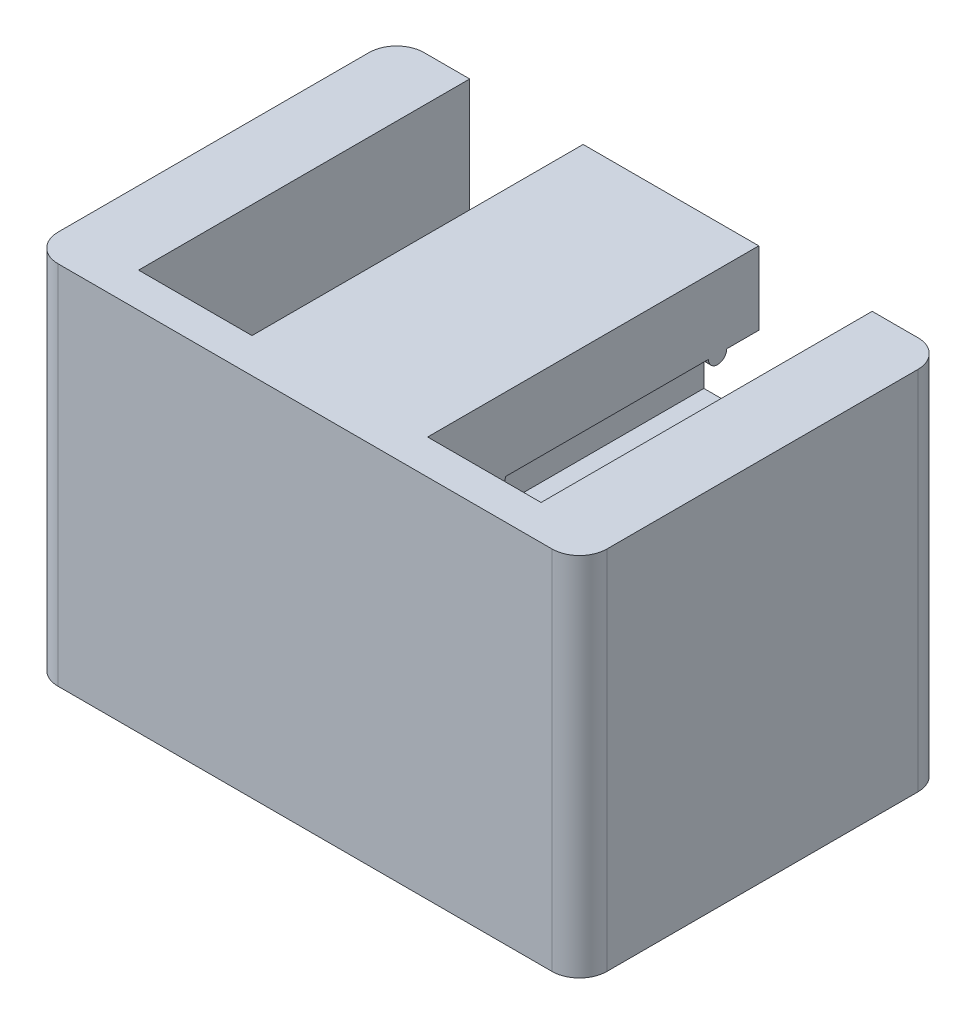
from build123d import *
from OCP.BRepFilletAPI import BRepFilletAPI_MakeChamfer

# Parameters (mm, degrees)
BOSS_EXTRUDE1_DEPTH           = 10
BOSS_EXTRUDE1_DEPTH_BACK      = 20
SKETCH12_R                    = 15
CUT_EXTRUDE9_DEPTH            = 8
CHAMFER1_SIZE                 = 1.5
CHAMFER1_SIZE2                = 0.46241
FILLET11_R                    = 0.78
CHAMFER2_SIZE2                = 5
CHAMFER2_SIZE                 = 8
CUT_EXTRUDE10_START           = -3
SKETCH18_W                    = 25.5
SKETCH18_H                    = 24.1
CUT_EXTRUDE10_DEPTH           = 4.1
SKETCH19_W                    = 8.6
SKETCH19_H                    = 8.6
CUT_EXTRUDE13_DEPTH           = 3.7
CUT_EXTRUDE14_DEPTH           = 2
SKETCH21_R                    = 3.8
CUT_EXTRUDE15_DEPTH           = 116.348128402
SKETCH10_R                    = 12.5
CUT_EXTRUDE8_DEPTH            = 3
SKETCH22_R                    = 0.95
BOSS_EXTRUDE5_DEPTH           = 1.1
BOSS_EXTRUDE5_DRAFT           = 30
BOSS_EXTRUDE5_PROFILE_2_DEPTH = 1.1
BOSS_EXTRUDE5_PROFILE_2_DRAFT = 30
BOSS_EXTRUDE5_PROFILE_3_DEPTH = 1.1
BOSS_EXTRUDE5_PROFILE_3_DRAFT = 30
BOSS_EXTRUDE5_PROFILE_4_DEPTH = 1.1
BOSS_EXTRUDE5_PROFILE_4_DRAFT = 30
CUT_EXTRUDE16_DEPTH           = 8.5
FILLET13_R                    = 2
BOSS_EXTRUDE6_DEPTH           = 3
LPATTERN1_COUNT               = 2
LPATTERN1_PITCH               = 150
LPATTERN1_COPY_1_SKETCH_R     = 0.95
LPATTERN1_COPY_1_DEPTH        = 1.1
LPATTERN1_COPY_1_DRAFT        = 30
LPATTERN1_COPY_2_SKETCH_R     = 0.95
LPATTERN1_COPY_2_DEPTH        = 1.1
LPATTERN1_COPY_2_DRAFT        = 30
LPATTERN1_COPY_3_SKETCH_R     = 0.95
LPATTERN1_COPY_3_DEPTH        = 1.1
LPATTERN1_COPY_3_DRAFT        = 30
LPATTERN1_COPY_4_SKETCH_R     = 0.95
LPATTERN1_COPY_4_DEPTH        = 1.1
LPATTERN1_COPY_4_DRAFT        = 30
LPATTERN1_COPY_5_SKETCH_R     = 0.95
LPATTERN1_COPY_5_DEPTH        = 1.1
LPATTERN1_COPY_5_DRAFT        = 30
LPATTERN1_COPY_6_SKETCH_R     = 0.95
LPATTERN1_COPY_6_DEPTH        = 1.1
LPATTERN1_COPY_6_DRAFT        = 30
LPATTERN1_COPY_7_SKETCH_R     = 0.95
LPATTERN1_COPY_7_DEPTH        = 1.1
LPATTERN1_COPY_7_DRAFT        = 30
FILLET13_OF_LPATTERN1_R       = 2
FILLET12_R                    = 100
FILLET14_R                    = 1
SKETCH32_R                    = 4.55
SKETCH32_R_2                  = 4.5
CUT_EXTRUDE17_DEPTH           = 3
SKETCH33_R                    = 2.75
CUT_EXTRUDE18_DEPTH           = 114.802213105
CUT_EXTRUDE19_DEPTH           = 5
SKETCH56_W                    = 30
SKETCH56_H                    = 20
BOSS_EXTRUDE10_DEPTH          = 20
CUT_EXTRUDE21_DEPTH           = 18.1
FILLET15_R                    = 1.5


# Read off the part's stored shape, not the designer's step: Split3
# Some blends are built 0.0001 mm under size
with BuildPart() as part:
    # Sketch1 → Boss-Extrude1 (new, two sides: drawn at the far end of the back side and taken through both)
    with BuildSketch(Plane.XY.offset(-BOSS_EXTRUDE1_DEPTH_BACK)):
        with BuildLine():
            Line((-100, -15), (0, -51.866662613))
            Line((0, -51.866662613), (100, -15))
            Line((100, -15), (100, 15))
            Line((100, 15), (60, 15))
            add(Edge.make_bspline(
                [(-60, 15), (-39.699350007, 14.814430853), (0, 45.185569147), (39.699350007, 14.814430853), (60, 15)],
                knots=[0, 0, 0, 0, 0.5, 1, 1, 1, 1], degree=3))
            Line((-60, 15), (-100, 15))
            Line((-100, 15), (-100, -15))
        make_face()
        with BuildLine():
            Line((3.188323159, 2.335673435), (2.875864874, 2.765735369))
            Line((2.875864874, 2.765735369), (4.089390366, 3.647413248))
            Line((4.089390366, 3.647413248), (4.40184865, 3.217351313))
            ThreePointArc((4.40184865, 3.217351313), (5.258610463, 4.17939586), (5.908815238, 5.29151288))
            Line((5.908815238, 5.29151288), (5.403247113, 5.455781921))
            Line((5.403247113, 5.455781921), (5.866772605, 6.882366696))
            Line((5.866772605, 6.882366696), (6.37234073, 6.718097654))
            ThreePointArc((6.37234073, 6.718097654), (6.5, 8), (6.37234073, 9.281902346))
            Line((6.37234073, 9.281902346), (5.866772605, 9.117633304))
            Line((5.866772605, 9.117633304), (5.403247113, 10.544218079))
            Line((5.403247113, 10.544218079), (5.908815238, 10.70848712))
            ThreePointArc((5.908815238, 10.70848712), (5.258610463, 11.82060414), (4.40184865, 12.782648687))
            Line((4.40184865, 12.782648687), (4.089390366, 12.352586752))
            Line((4.089390366, 12.352586752), (2.875864874, 13.234264631))
            Line((2.875864874, 13.234264631), (3.188323159, 13.664326565))
            ThreePointArc((3.188323159, 13.664326565), (2.008610463, 14.181867356), (0.75, 14.456585785))
            Line((0.75, 14.456585785), (0.75, 13.925))
            Line((0.75, 13.925), (-0.75, 13.925))
            Line((-0.75, 13.925), (-0.75, 14.456585785))
            ThreePointArc((-0.75, 14.456585785), (-2.008610463, 14.181867356), (-3.188323159, 13.664326565))
            Line((-3.188323159, 13.664326565), (-2.875864874, 13.234264631))
            Line((-2.875864874, 13.234264631), (-4.089390366, 12.352586752))
            Line((-4.089390366, 12.352586752), (-4.40184865, 12.782648687))
            ThreePointArc((-4.40184865, 12.782648687), (-5.258610463, 11.82060414), (-5.908815238, 10.70848712))
            Line((-5.908815238, 10.70848712), (-5.403247113, 10.544218079))
            Line((-5.403247113, 10.544218079), (-5.866772605, 9.117633304))
            Line((-5.866772605, 9.117633304), (-6.37234073, 9.281902346))
            ThreePointArc((-6.37234073, 9.281902346), (-6.5, 8), (-6.37234073, 6.718097654))
            Line((-6.37234073, 6.718097654), (-5.866772605, 6.882366696))
            Line((-5.866772605, 6.882366696), (-5.403247113, 5.455781921))
            Line((-5.403247113, 5.455781921), (-5.908815238, 5.29151288))
            ThreePointArc((-5.908815238, 5.29151288), (-5.258610463, 4.17939586), (-4.40184865, 3.217351313))
            Line((-4.40184865, 3.217351313), (-4.089390366, 3.647413248))
            Line((-4.089390366, 3.647413248), (-2.875864874, 2.765735369))
            Line((-2.875864874, 2.765735369), (-3.188323159, 2.335673435))
            ThreePointArc((-3.188323159, 2.335673435), (-2.008610463, 1.818132644), (-0.75, 1.543414215))
            Line((-0.75, 1.543414215), (-0.75, 2.075))
            Line((-0.75, 2.075), (0.75, 2.075))
            Line((0.75, 2.075), (0.75, 1.543414215))
            ThreePointArc((0.75, 1.543414215), (2.008610463, 1.818132644), (3.188323159, 2.335673435))
        make_face(mode=Mode.SUBTRACT)
    extrude(amount=BOSS_EXTRUDE1_DEPTH + BOSS_EXTRUDE1_DEPTH_BACK)

    # Sketch12 → Cut-Extrude9 (cut)
    with BuildSketch(Plane(origin=(0, 0, -20), x_dir=(-1, 0, 0), z_dir=(0, 0, -1))):
        with Locations((0, 8)):
            Circle(SKETCH12_R)
    extrude(amount=-CUT_EXTRUDE9_DEPTH, mode=Mode.SUBTRACT)

    # Chamfer1: one chamfer whose edges measure the first distance from different faces: ONE call of the kernel's chamfer builder (chamfer() names one face for all edges)
    chamfer1_edges_1 = [part.edges().sort_by_distance(p)[0] for p in [
        (0, 2.075, -12),
    ]]
    chamfer1_side_1 = [part.faces().sort_by_distance(p)[0] for p in [
        (0, 2.075, -1),
    ]]
    chamfer1_edges_2 = [part.edges().sort_by_distance(p)[0] for p in [
        (3.48262762, 3.206574308, -12),
    ]]
    chamfer1_side_2 = [part.faces().sort_by_distance(p)[0] for p in [
        (3.48262762, 3.206574308, -1),
    ]]
    chamfer1_edges_3 = [part.edges().sort_by_distance(p)[0] for p in [
        (5.635009859, 6.169074308, -12),
    ]]
    chamfer1_side_3 = [part.faces().sort_by_distance(p)[0] for p in [
        (5.635009859, 6.169074308, -1),
    ]]
    chamfer1_edges_4 = [part.edges().sort_by_distance(p)[0] for p in [
        (5.635009859, 9.830925692, -12),
    ]]
    chamfer1_side_4 = [part.faces().sort_by_distance(p)[0] for p in [
        (5.635009859, 9.830925692, -1),
    ]]
    chamfer1_edges_5 = [part.edges().sort_by_distance(p)[0] for p in [
        (3.48262762, 12.793425692, -12),
    ]]
    chamfer1_side_5 = [part.faces().sort_by_distance(p)[0] for p in [
        (3.48262762, 12.793425692, -1),
    ]]
    chamfer1_edges_6 = [part.edges().sort_by_distance(p)[0] for p in [
        (0, 13.925, -12),
    ]]
    chamfer1_side_6 = [part.faces().sort_by_distance(p)[0] for p in [
        (0, 13.925, -1),
    ]]
    chamfer1_edges_7 = [part.edges().sort_by_distance(p)[0] for p in [
        (-3.48262762, 12.793425692, -12),
    ]]
    chamfer1_side_7 = [part.faces().sort_by_distance(p)[0] for p in [
        (-3.48262762, 12.793425692, -1),
    ]]
    chamfer1_edges_8 = [part.edges().sort_by_distance(p)[0] for p in [
        (-5.635009859, 9.830925692, -12),
    ]]
    chamfer1_side_8 = [part.faces().sort_by_distance(p)[0] for p in [
        (-5.635009859, 9.830925692, -1),
    ]]
    chamfer1_edges_9 = [part.edges().sort_by_distance(p)[0] for p in [
        (-5.635009859, 6.169074308, -12),
    ]]
    chamfer1_side_9 = [part.faces().sort_by_distance(p)[0] for p in [
        (-5.635009859, 6.169074308, -1),
    ]]
    chamfer1_edges_10 = [part.edges().sort_by_distance(p)[0] for p in [
        (-3.48262762, 3.206574308, -12),
    ]]
    chamfer1_side_10 = [part.faces().sort_by_distance(p)[0] for p in [
        (-3.48262762, 3.206574308, -1),
    ]]
    chamfer1 = BRepFilletAPI_MakeChamfer(part.part.solid().wrapped)
    for e in chamfer1_edges_1:
        chamfer1.Add(CHAMFER1_SIZE, CHAMFER1_SIZE2, e.wrapped, chamfer1_side_1[0].wrapped)  # the first distance lies on this face
    for e in chamfer1_edges_2:
        chamfer1.Add(CHAMFER1_SIZE, CHAMFER1_SIZE2, e.wrapped, chamfer1_side_2[0].wrapped)  # the first distance lies on this face
    for e in chamfer1_edges_3:
        chamfer1.Add(CHAMFER1_SIZE, CHAMFER1_SIZE2, e.wrapped, chamfer1_side_3[0].wrapped)  # the first distance lies on this face
    for e in chamfer1_edges_4:
        chamfer1.Add(CHAMFER1_SIZE, CHAMFER1_SIZE2, e.wrapped, chamfer1_side_4[0].wrapped)  # the first distance lies on this face
    for e in chamfer1_edges_5:
        chamfer1.Add(CHAMFER1_SIZE, CHAMFER1_SIZE2, e.wrapped, chamfer1_side_5[0].wrapped)  # the first distance lies on this face
    for e in chamfer1_edges_6:
        chamfer1.Add(CHAMFER1_SIZE, CHAMFER1_SIZE2, e.wrapped, chamfer1_side_6[0].wrapped)  # the first distance lies on this face
    for e in chamfer1_edges_7:
        chamfer1.Add(CHAMFER1_SIZE, CHAMFER1_SIZE2, e.wrapped, chamfer1_side_7[0].wrapped)  # the first distance lies on this face
    for e in chamfer1_edges_8:
        chamfer1.Add(CHAMFER1_SIZE, CHAMFER1_SIZE2, e.wrapped, chamfer1_side_8[0].wrapped)  # the first distance lies on this face
    for e in chamfer1_edges_9:
        chamfer1.Add(CHAMFER1_SIZE, CHAMFER1_SIZE2, e.wrapped, chamfer1_side_9[0].wrapped)  # the first distance lies on this face
    for e in chamfer1_edges_10:
        chamfer1.Add(CHAMFER1_SIZE, CHAMFER1_SIZE2, e.wrapped, chamfer1_side_10[0].wrapped)  # the first distance lies on this face
    add(Compound.cast(chamfer1.Shape()), mode=Mode.REPLACE)

    # Fillet11
    # the kernel refuses this fillet: 0.78 mm, written as the material it takes off along each edge
    with BuildSketch(Plane(origin=(-4.089390366, 12.352586752, -12.348462837), x_dir=(-0.5877852522924715, 0.8090169943749486, 0), z_dir=(0, 0, 1)), Plane(origin=(-5.866772605, 9.117633304, -12.348462837), x_dir=(-0.9510565162951549, 0.3090169943749433, 0), z_dir=(0, 0, 1)), Plane(origin=(-0.75, 13.925, -12.348462837), x_dir=(0, 1, 0), z_dir=(0, 0, 1)), Plane(origin=(2.875864874, 13.234264631, -12.348462837), x_dir=(0.5877852522924727, 0.8090169943749479, 0), z_dir=(0, 0, 1)), Plane(origin=(5.403247113, 10.544218079, -12.348462837), x_dir=(0.9510565162951538, 0.30901699437494734, 0), z_dir=(0, 0, 1)), Plane(origin=(5.866772605, 6.882366696, -12.348462837), x_dir=(0.9510565162951544, -0.30901699437494534, 0), z_dir=(0, 0, 1)), Plane(origin=(-5.403247113, 5.455781921, -12.348462837), x_dir=(-0.9510565162951544, -0.30901699437494484, 0), z_dir=(0, 0, 1)), Plane(origin=(-2.875864874, 2.765735369, -12.348462837), x_dir=(-0.5877852522924728, -0.8090169943749477, 0), z_dir=(0, 0, 1)), Plane(origin=(0.75, 2.075, -12.348462837), x_dir=(0, -1, 0), z_dir=(0, 0, 1)), Plane(origin=(4.089390366, 3.647413248, -12.348462837), x_dir=(0.5877852522924725, -0.8090169943749479, 0), z_dir=(0, 0, 1))) as fillet11_piece_1:
        with BuildLine():
            CenterArc((0.78, -0.739385135), FILLET11_R, 108.571012268, 71.428987732)
            Line((0, -0.739385135), (-0.0156, -0.739385135))
            Line((-0.0156, -0.739385135), (-0.0156, 0))
            Line((-0.0156, 0), (0, 0.0156))
            ThreePointArc((0, 0.0156), (0.265792893, 0.0156), (0.526617501, 0.014787703))
            Line((0.526617501, 0.014787703), (0.531585785, 0))
        make_face()
    extrude(amount=24.196925675, mode=Mode.SUBTRACT)
    with BuildSketch(Plane(origin=(-5.403247113, 10.544218079, -12.348462837), x_dir=(-0.3090169943749473, -0.9510565162951535, 0), z_dir=(0, 0, 1)), Plane(origin=(-2.875864874, 13.234264631, -12.348462837), x_dir=(-0.809016994374947, -0.5877852522924738, 0), z_dir=(0, 0, 1)), Plane(origin=(0.75, 13.925, -12.348462837), x_dir=(-1, 0, 0), z_dir=(0, 0, 1)), Plane(origin=(4.089390366, 12.352586752, -12.348462837), x_dir=(-0.8090169943749471, 0.5877852522924735, 0), z_dir=(0, 0, 1)), Plane(origin=(5.866772605, 9.117633304, -12.348462837), x_dir=(-0.30901699437494623, 0.951056516295154, 0), z_dir=(0, 0, 1)), Plane(origin=(5.403247113, 5.455781921, -12.348462837), x_dir=(0.30901699437494773, 0.9510565162951536, 0), z_dir=(0, 0, 1)), Plane(origin=(-5.866772605, 6.882366696, -12.348462837), x_dir=(0.3090169943749473, -0.9510565162951536, 0), z_dir=(0, 0, 1)), Plane(origin=(-4.089390366, 3.647413248, -12.348462837), x_dir=(0.809016994374947, -0.5877852522924737, 0), z_dir=(0, 0, 1)), Plane(origin=(-0.75, 2.075, -12.348462837), x_dir=(1, 0, 0), z_dir=(0, 0, 1)), Plane(origin=(2.875864874, 2.765735369, -12.348462837), x_dir=(0.8090169943749471, 0.5877852522924735, 0), z_dir=(0, 0, 1))) as fillet11_piece_2:
        with BuildLine():
            CenterArc((0.739385135, -0.78), FILLET11_R, 90, 71.428987732)
            Line((0, -0.531585785), (-0.014787703, -0.526617501))
            ThreePointArc((-0.014787703, -0.526617501), (-0.0156, -0.265792893), (-0.0156, 0))
            Line((-0.0156, 0), (0, 0.0156))
            Line((0, 0.0156), (0.739385135, 0.0156))
            Line((0.739385135, 0.0156), (0.739385135, 0))
        make_face()
    extrude(amount=24.196925675, mode=Mode.SUBTRACT)

    # Chamfer2
    chamfer2_edges = [part.edges().sort_by_distance(p)[0] for p in [
        (15, 8, -20),
    ]]
    chamfer2_side = [part.faces().sort_by_distance(p)[0] for p in [
        (15, 8, -19.9),
    ]]
    chamfer(chamfer2_edges, length=CHAMFER2_SIZE - 0.0001, length2=CHAMFER2_SIZE2 - 0.0001, reference=chamfer2_side[0])  # a hair under: the kernel refuses the full size

    # Sketch18 → Cut-Extrude10 (cut)
    with BuildSketch(Plane.XY.offset(CUT_EXTRUDE10_START)):
        with Locations((-75, 0.285)):
            Rectangle(SKETCH18_W, SKETCH18_H)
    cut_extrude10 = extrude(amount=CUT_EXTRUDE10_DEPTH, mode=Mode.SUBTRACT)

    # Sketch19 → Cut-Extrude13 (cut)
    with BuildSketch(Plane(origin=(0, 0, 1.1), x_dir=(-1, 0, 0), z_dir=(0, 0, -1))):
        with Locations((75, -2.265)):
            Rectangle(SKETCH19_W, SKETCH19_H)
    cut_extrude13 = extrude(amount=-CUT_EXTRUDE13_DEPTH, mode=Mode.SUBTRACT)

    # Sketch20 → Cut-Extrude14 (cut)
    with BuildSketch(Plane(origin=(0, 0, 1.1), x_dir=(-1, 0, 0), z_dir=(0, 0, -1))):
        Polygon((79.3, 2.035), (79.3, 5.335), (81.5, 5.335), (81.5, 9.835), (70.7, 9.835), (70.7, 2.035), align=None)
    cut_extrude14 = extrude(amount=-CUT_EXTRUDE14_DEPTH, mode=Mode.SUBTRACT)

    # Sketch21 → Cut-Extrude15 (cut, through all)
    with BuildSketch(Plane(origin=(0, 0, 4.8), x_dir=(-1, 0, 0), z_dir=(0, 0, -1))):
        with Locations((75, -2.265)):
            Circle(SKETCH21_R)
    cut_extrude15 = extrude(amount=-CUT_EXTRUDE15_DEPTH, mode=Mode.SUBTRACT)

    # Sketch10 → Cut-Extrude8 (cut)
    with BuildSketch(Plane.XY.offset(10)):
        with Locations((-75, -2.265)):
            Circle(SKETCH10_R)
    cut_extrude8 = extrude(amount=-CUT_EXTRUDE8_DEPTH, mode=Mode.SUBTRACT)


with BuildPart() as boss_extrude5_tool:
    # Sketch22 → Boss-Extrude5 (with draft: the straight prism first)
    with BuildSketch(Plane(origin=(0, 0, 1.1), x_dir=(-1, 0, 0), z_dir=(0, 0, -1))):
        with Locations((64.35, 10.235)):
            Circle(SKETCH22_R)
    extrude(amount=BOSS_EXTRUDE5_DEPTH)
    # Boss-Extrude5: the draft: its side faces are tilted about the plane it starts from
    boss_extrude5_sides = [boss_extrude5_tool.faces().sort_by_distance(p)[0] for p in [
        (-63.4, 10.235, 0.55),
    ]]
    draft(boss_extrude5_sides, Plane(origin=(0, 0, 1.1), x_dir=(-1, 0, 0), z_dir=(0, 0, -1)), BOSS_EXTRUDE5_DRAFT)


with BuildPart() as part_1:
    add(part.part)

    # Boss-Extrude5: add boss_extrude5_tool
    add(boss_extrude5_tool.part)


with BuildPart() as boss_extrude5_profile_2_tool:
    # Sketch22 → Boss-Extrude5 profile 2 (with draft: the straight prism first)
    with BuildSketch(Plane(origin=(0, 0, 1.1), x_dir=(-1, 0, 0), z_dir=(0, 0, -1))):
        with Locations((85.65, 10.235)):
            Circle(SKETCH22_R)
    extrude(amount=BOSS_EXTRUDE5_PROFILE_2_DEPTH)
    # Boss-Extrude5 profile 2: the draft: its side faces are tilted about the plane it starts from
    boss_extrude5_profile_2_sides = [boss_extrude5_profile_2_tool.faces().sort_by_distance(p)[0] for p in [
        (-84.7, 10.235, 0.55),
    ]]
    draft(boss_extrude5_profile_2_sides, Plane(origin=(0, 0, 1.1), x_dir=(-1, 0, 0), z_dir=(0, 0, -1)), BOSS_EXTRUDE5_PROFILE_2_DRAFT)


with BuildPart() as part_2:
    add(part_1.part)

    # Boss-Extrude5 profile 2: add boss_extrude5_profile_2_tool
    add(boss_extrude5_profile_2_tool.part)


with BuildPart() as boss_extrude5_profile_3_tool:
    # Sketch22 → Boss-Extrude5 profile 3 (with draft: the straight prism first)
    with BuildSketch(Plane(origin=(0, 0, 1.1), x_dir=(-1, 0, 0), z_dir=(0, 0, -1))):
        with Locations((85.65, -2.105)):
            Circle(SKETCH22_R)
    extrude(amount=BOSS_EXTRUDE5_PROFILE_3_DEPTH)
    # Boss-Extrude5 profile 3: the draft: its side faces are tilted about the plane it starts from
    boss_extrude5_profile_3_sides = [boss_extrude5_profile_3_tool.faces().sort_by_distance(p)[0] for p in [
        (-84.7, -2.105, 0.55),
    ]]
    draft(boss_extrude5_profile_3_sides, Plane(origin=(0, 0, 1.1), x_dir=(-1, 0, 0), z_dir=(0, 0, -1)), BOSS_EXTRUDE5_PROFILE_3_DRAFT)


with BuildPart() as part_3:
    add(part_2.part)

    # Boss-Extrude5 profile 3: add boss_extrude5_profile_3_tool
    add(boss_extrude5_profile_3_tool.part)


with BuildPart() as boss_extrude5_profile_4_tool:
    # Sketch22 → Boss-Extrude5 profile 4 (with draft: the straight prism first)
    with BuildSketch(Plane(origin=(0, 0, 1.1), x_dir=(-1, 0, 0), z_dir=(0, 0, -1))):
        with Locations((64.35, -2.105)):
            Circle(SKETCH22_R)
    extrude(amount=BOSS_EXTRUDE5_PROFILE_4_DEPTH)
    # Boss-Extrude5 profile 4: the draft: its side faces are tilted about the plane it starts from
    boss_extrude5_profile_4_sides = [boss_extrude5_profile_4_tool.faces().sort_by_distance(p)[0] for p in [
        (-63.4, -2.105, 0.55),
    ]]
    draft(boss_extrude5_profile_4_sides, Plane(origin=(0, 0, 1.1), x_dir=(-1, 0, 0), z_dir=(0, 0, -1)), BOSS_EXTRUDE5_PROFILE_4_DRAFT)


with BuildPart() as part_4:
    add(part_3.part)

    # Boss-Extrude5 profile 4: add boss_extrude5_profile_4_tool
    add(boss_extrude5_profile_4_tool.part)

    # Sketch24 → Cut-Extrude16 (cut, symmetric)
    with BuildSketch(Plane(origin=(-75, 0, 0), x_dir=(0, 0, -1), z_dir=(1, 0, 0))):
        Polygon((0.8, -11.765), (0.8, -19.265), (20, -19.265), (20, -18.065), (2, -18.065), (2, -11.765), align=None)
    cut_extrude16 = extrude(amount=CUT_EXTRUDE16_DEPTH, both=True, mode=Mode.SUBTRACT)

    # Fillet13
    fillet13_edges = [part_4.edges().sort_by_distance(p)[0] for p in [
        (-75, -19.265, -0.8),
        (-75, -18.065, -2),
    ]]
    fillet(fillet13_edges, radius=FILLET13_R)

    # Sketch25 → Boss-Extrude6 (add)
    with BuildSketch(Plane.XY.offset(-3)):
        with BuildLine():
            Line((-84.672341587, 10.739166667), (-83.303552478, 10.739166667))
            ThreePointArc((-83.303552478, 10.739166667), (-83.952943725, 8.537943725), (-86.154166667, 7.888552478))
            Line((-86.154166667, 7.888552478), (-86.154166667, 9.257341587))
            ThreePointArc((-86.154166667, 9.257341587), (-84.872182541, 9.457182541), (-84.672341587, 10.739166667))
        make_face()
        with BuildLine():
            Line((-65.327658413, 10.739166667), (-66.696447522, 10.739166667))
            ThreePointArc((-66.696447522, 10.739166667), (-66.047056275, 8.537943725), (-63.845833333, 7.888552478))
            Line((-63.845833333, 7.888552478), (-63.845833333, 9.257341587))
            ThreePointArc((-63.845833333, 9.257341587), (-65.127817459, 9.457182541), (-65.327658413, 10.739166667))
        make_face()
        with BuildLine():
            Line((-85.65, -1.005), (-85.65, 0.295))
            ThreePointArc((-85.65, 0.295), (-83.25, -2.105), (-85.65, -4.505))
            Line((-85.65, -4.505), (-85.65, -3.205))
            ThreePointArc((-85.65, -3.205), (-84.55, -2.105), (-85.65, -1.005))
        make_face()
        with BuildLine():
            Line((-64.35, -3.205), (-64.35, -4.505))
            ThreePointArc((-64.35, -4.505), (-66.75, -2.105), (-64.35, 0.295))
            Line((-64.35, 0.295), (-64.35, -1.005))
            ThreePointArc((-64.35, -1.005), (-65.45, -2.105), (-64.35, -3.205))
        make_face()
    boss_extrude6 = extrude(amount=BOSS_EXTRUDE6_DEPTH)

    # LPattern1: Cut-Extrude10, Cut-Extrude13, Cut-Extrude14, Cut-Extrude15, Cut-Extrude8, Cut-Extrude16, Boss-Extrude6 ×2
    with Locations(*[(i * LPATTERN1_PITCH, 0, 0) for i in range(1, LPATTERN1_COUNT)]):
        add(cut_extrude10, mode=Mode.SUBTRACT)
        add(cut_extrude13, mode=Mode.SUBTRACT)
        add(cut_extrude14, mode=Mode.SUBTRACT)
        add(cut_extrude15, mode=Mode.SUBTRACT)
        add(cut_extrude8, mode=Mode.SUBTRACT)
        add(cut_extrude16, mode=Mode.SUBTRACT)
        add(boss_extrude6)


with BuildPart() as lpattern1_copy_1_tool:
    # LPattern1 copy 1 sketch → LPattern1 copy 1 (with draft: the straight prism first)
    with BuildSketch(Plane(origin=(150, 0, 1.1), x_dir=(-1, 0, 0), z_dir=(0, 0, -1))):
        with Locations((64.35, 10.235)):
            Circle(LPATTERN1_COPY_1_SKETCH_R)
    extrude(amount=LPATTERN1_COPY_1_DEPTH)
    # LPattern1 copy 1: the draft: its side faces are tilted about the plane it starts from
    lpattern1_copy_1_sides = [lpattern1_copy_1_tool.faces().sort_by_distance(p)[0] for p in [
        (86.6, 10.235, 0.55),
    ]]
    draft(lpattern1_copy_1_sides, Plane(origin=(150, 0, 1.1), x_dir=(-1, 0, 0), z_dir=(0, 0, -1)), LPATTERN1_COPY_1_DRAFT)


with BuildPart() as part_5:
    add(part_4.part)

    # LPattern1 copy 1: add lpattern1_copy_1_tool
    add(lpattern1_copy_1_tool.part)


with BuildPart() as lpattern1_copy_2_tool:
    # LPattern1 copy 2 sketch → LPattern1 copy 2 (with draft: the straight prism first)
    with BuildSketch(Plane(origin=(150, 0, 1.1), x_dir=(-1, 0, 0), z_dir=(0, 0, -1))):
        with Locations((85.65, 10.235)):
            Circle(LPATTERN1_COPY_2_SKETCH_R)
    extrude(amount=LPATTERN1_COPY_2_DEPTH)
    # LPattern1 copy 2: the draft: its side faces are tilted about the plane it starts from
    lpattern1_copy_2_sides = [lpattern1_copy_2_tool.faces().sort_by_distance(p)[0] for p in [
        (65.3, 10.235, 0.55),
    ]]
    draft(lpattern1_copy_2_sides, Plane(origin=(150, 0, 1.1), x_dir=(-1, 0, 0), z_dir=(0, 0, -1)), LPATTERN1_COPY_2_DRAFT)


with BuildPart() as part_6:
    add(part_5.part)

    # LPattern1 copy 2: add lpattern1_copy_2_tool
    add(lpattern1_copy_2_tool.part)


with BuildPart() as lpattern1_copy_3_tool:
    # LPattern1 copy 3 sketch → LPattern1 copy 3 (with draft: the straight prism first)
    with BuildSketch(Plane(origin=(150, 0, 1.1), x_dir=(-1, 0, 0), z_dir=(0, 0, -1))):
        with Locations((85.65, -2.105)):
            Circle(LPATTERN1_COPY_3_SKETCH_R)
    extrude(amount=LPATTERN1_COPY_3_DEPTH)
    # LPattern1 copy 3: the draft: its side faces are tilted about the plane it starts from
    lpattern1_copy_3_sides = [lpattern1_copy_3_tool.faces().sort_by_distance(p)[0] for p in [
        (65.3, -2.105, 0.55),
    ]]
    draft(lpattern1_copy_3_sides, Plane(origin=(150, 0, 1.1), x_dir=(-1, 0, 0), z_dir=(0, 0, -1)), LPATTERN1_COPY_3_DRAFT)


with BuildPart() as part_7:
    add(part_6.part)

    # LPattern1 copy 3: add lpattern1_copy_3_tool
    add(lpattern1_copy_3_tool.part)


with BuildPart() as lpattern1_copy_4_tool:
    # LPattern1 copy 4 sketch → LPattern1 copy 4 (with draft: the straight prism first)
    with BuildSketch(Plane(origin=(150, 0, 1.1), x_dir=(-1, 0, 0), z_dir=(0, 0, -1))):
        with Locations((64.35, -2.105)):
            Circle(LPATTERN1_COPY_4_SKETCH_R)
    extrude(amount=LPATTERN1_COPY_4_DEPTH)
    # LPattern1 copy 4: the draft: its side faces are tilted about the plane it starts from
    lpattern1_copy_4_sides = [lpattern1_copy_4_tool.faces().sort_by_distance(p)[0] for p in [
        (86.6, -2.105, 0.55),
    ]]
    draft(lpattern1_copy_4_sides, Plane(origin=(150, 0, 1.1), x_dir=(-1, 0, 0), z_dir=(0, 0, -1)), LPATTERN1_COPY_4_DRAFT)


with BuildPart() as part_8:
    add(part_7.part)

    # LPattern1 copy 4: add lpattern1_copy_4_tool
    add(lpattern1_copy_4_tool.part)


with BuildPart() as lpattern1_copy_5_tool:
    # LPattern1 copy 5 sketch → LPattern1 copy 5 (with draft: the straight prism first)
    with BuildSketch(Plane(origin=(150, 0, 1.1), x_dir=(-1, 0, 0), z_dir=(0, 0, -1))):
        with Locations((85.65, 10.235)):
            Circle(LPATTERN1_COPY_5_SKETCH_R)
    extrude(amount=LPATTERN1_COPY_5_DEPTH)
    # LPattern1 copy 5: the draft: its side faces are tilted about the plane it starts from
    lpattern1_copy_5_sides = [lpattern1_copy_5_tool.faces().sort_by_distance(p)[0] for p in [
        (65.3, 10.235, 0.55),
    ]]
    draft(lpattern1_copy_5_sides, Plane(origin=(150, 0, 1.1), x_dir=(-1, 0, 0), z_dir=(0, 0, -1)), LPATTERN1_COPY_5_DRAFT)


with BuildPart() as part_9:
    add(part_8.part)

    # LPattern1 copy 5: add lpattern1_copy_5_tool
    add(lpattern1_copy_5_tool.part)


with BuildPart() as lpattern1_copy_6_tool:
    # LPattern1 copy 6 sketch → LPattern1 copy 6 (with draft: the straight prism first)
    with BuildSketch(Plane(origin=(150, 0, 1.1), x_dir=(-1, 0, 0), z_dir=(0, 0, -1))):
        with Locations((85.65, -2.105)):
            Circle(LPATTERN1_COPY_6_SKETCH_R)
    extrude(amount=LPATTERN1_COPY_6_DEPTH)
    # LPattern1 copy 6: the draft: its side faces are tilted about the plane it starts from
    lpattern1_copy_6_sides = [lpattern1_copy_6_tool.faces().sort_by_distance(p)[0] for p in [
        (65.3, -2.105, 0.55),
    ]]
    draft(lpattern1_copy_6_sides, Plane(origin=(150, 0, 1.1), x_dir=(-1, 0, 0), z_dir=(0, 0, -1)), LPATTERN1_COPY_6_DRAFT)


with BuildPart() as part_10:
    add(part_9.part)

    # LPattern1 copy 6: add lpattern1_copy_6_tool
    add(lpattern1_copy_6_tool.part)


with BuildPart() as lpattern1_copy_7_tool:
    # LPattern1 copy 7 sketch → LPattern1 copy 7 (with draft: the straight prism first)
    with BuildSketch(Plane(origin=(150, 0, 1.1), x_dir=(-1, 0, 0), z_dir=(0, 0, -1))):
        with Locations((64.35, -2.105)):
            Circle(LPATTERN1_COPY_7_SKETCH_R)
    extrude(amount=LPATTERN1_COPY_7_DEPTH)
    # LPattern1 copy 7: the draft: its side faces are tilted about the plane it starts from
    lpattern1_copy_7_sides = [lpattern1_copy_7_tool.faces().sort_by_distance(p)[0] for p in [
        (86.6, -2.105, 0.55),
    ]]
    draft(lpattern1_copy_7_sides, Plane(origin=(150, 0, 1.1), x_dir=(-1, 0, 0), z_dir=(0, 0, -1)), LPATTERN1_COPY_7_DRAFT)


with BuildPart() as part_11:
    add(part_10.part)

    # LPattern1 copy 7: add lpattern1_copy_7_tool
    add(lpattern1_copy_7_tool.part)

    # Fillet13 of LPattern1
    fillet13_of_lpattern1_edges = [part_11.edges().sort_by_distance(p)[0] for p in [
        (75, -19.265, -0.8),
        (75, -18.065, -2),
    ]]
    fillet(fillet13_of_lpattern1_edges, radius=FILLET13_OF_LPATTERN1_R)

    # Fillet12
    fillet12_edges = [part_11.edges().sort_by_distance(p)[0] for p in [
        (0, -51.866662613, -5),
    ]]
    fillet(fillet12_edges, radius=FILLET12_R)

    # Fillet14
    fillet14_edges = [part_11.edges().sort_by_distance(p)[0] for p in [
        (19.9999, 8, -20),
        (-87.5, -2.265, 10),
        (62.5, -2.265, 10),
    ]]
    fillet(fillet14_edges, radius=FILLET14_R)

    # Sketch32 → Cut-Extrude17 (cut)
    with BuildSketch(Plane.XY.offset(10)):
        with Locations((-93.5, -2.271550921)):
            Circle(SKETCH32_R)
        with Locations((-28.332209431, 14.008347309)):
            Circle(SKETCH32_R_2)
        with Locations((0, -32.79283808)):
            Circle(SKETCH32_R_2)
    cut_extrude17 = extrude(amount=-CUT_EXTRUDE17_DEPTH, mode=Mode.SUBTRACT)

    # Sketch33 → Cut-Extrude18 (cut, through all)
    with BuildSketch(Plane.XY.offset(10)):
        with Locations((-28.332209431, 14.008347309)):
            Circle(SKETCH33_R)
        with Locations((-93.5, -2.271550921)):
            Circle(SKETCH33_R)
        with Locations((0, -32.79283808)):
            Circle(SKETCH33_R)
    cut_extrude18 = extrude(amount=-CUT_EXTRUDE18_DEPTH, mode=Mode.SUBTRACT)

    # Sketch35 → Cut-Extrude19 (cut)
    with BuildSketch(Plane(origin=(0, 0, -20), x_dir=(-1, 0, 0), z_dir=(0, 0, -1))):
        Polygon((4.55, -30.165894355), (0, -27.53895063), (-4.55, -30.165894355), (-4.55, -35.419781805), (0, -38.04672553), (4.55, -35.419781805), align=None)
        Polygon((32.882209431, 16.635291034), (28.332209431, 19.262234759), (23.782209431, 16.635291034), (23.782209431, 11.381403584), (28.332209431, 8.75445986), (32.882209431, 11.381403584), align=None)
        Polygon((98.05, 0.355392804), (93.5, 2.982336529), (88.95, 0.355392804), (88.95, -4.898494646), (93.5, -7.525438371), (98.05, -4.898494646), align=None)
    cut_extrude19 = extrude(amount=-CUT_EXTRUDE19_DEPTH, mode=Mode.SUBTRACT)

    # Mirror1: Cut-Extrude17, Cut-Extrude18, Cut-Extrude19 across plane
    add(cut_extrude17.mirror(Plane(origin=(0, 0, 0), x_dir=(0, 0, 1), z_dir=(1, 0, 0))), mode=Mode.SUBTRACT)
    add(cut_extrude18.mirror(Plane(origin=(0, 0, 0), x_dir=(0, 0, 1), z_dir=(1, 0, 0))), mode=Mode.SUBTRACT)
    add(cut_extrude19.mirror(Plane(origin=(0, 0, 0), x_dir=(0, 0, 1), z_dir=(1, 0, 0))), mode=Mode.SUBTRACT)

    # Split2
    split(bisect_by=Plane.XY, keep=Keep.BOTTOM)


with BuildPart() as body_2:
    # Sketch56 → Boss-Extrude10 (new body)
    with BuildSketch(Plane.XY):
        with Locations((0, -55.287345613)):
            Rectangle(SKETCH56_W, SKETCH56_H)
    extrude(amount=-BOSS_EXTRUDE10_DEPTH)

    # Sketch46 → Cut-Extrude21 (cut)
    with BuildSketch(Plane(origin=(0, 0, -20), x_dir=(-1, 0, 0), z_dir=(0, 0, -1))):
        Polygon((-11, -45.287345613), (-11, -53.537345613), (-1.8, -53.537345613), (-1.8, -49.287345613), (-4.8, -49.287345613), (-4.8, -45.287345613), align=None)
        Polygon((4.8, -49.287345613), (4.8, -45.287345613), (11, -45.287345613), (11, -53.537345613), (1.8, -53.537345613), (1.8, -49.287345613), align=None)
    extrude(amount=-CUT_EXTRUDE21_DEPTH, mode=Mode.SUBTRACT)

    # Sweep10: sweep along a path in Sketch55
    with BuildLine(Plane.XZ.offset(49.287345613)) as sweep10_path:
        Line((-1.8, -17.66984137), (-4.8, -17.66984137))
    # Sketch54 → Sweep10 (sweep)
    with BuildSketch(Plane.ZY.offset(1.8)):
        with BuildLine():
            Line((-5.15, -49.287345613), (-6.15, -49.287345613))
            ThreePointArc((-6.15, -49.287345613), (-5.65, -49.787345613), (-5.15, -49.287345613))
        make_face()
        with BuildLine():
            Line((-18.25, -49.287345613), (-17.25, -49.287345613))
            ThreePointArc((-17.25, -49.287345613), (-17.75, -49.787345613), (-18.25, -49.287345613))
        make_face()
    sweep10 = sweep(path=sweep10_path.line)

    # Mirror2: Sweep10 across plane
    add(sweep10.mirror(Plane(origin=(0, 0, 0), x_dir=(0, 0, 1), z_dir=(1, 0, 0))))

    # Fillet15
    fillet15_edges = [body_2.edges().sort_by_distance(p)[0] for p in [
        (15, -55.287345613, -20),
        (-15, -55.287345613, -20),
        (15, -55.287345613, 0),
        (-15, -55.287345613, 0),
    ]]
    fillet(fillet15_edges, radius=FILLET15_R)


solid = body_2.part
